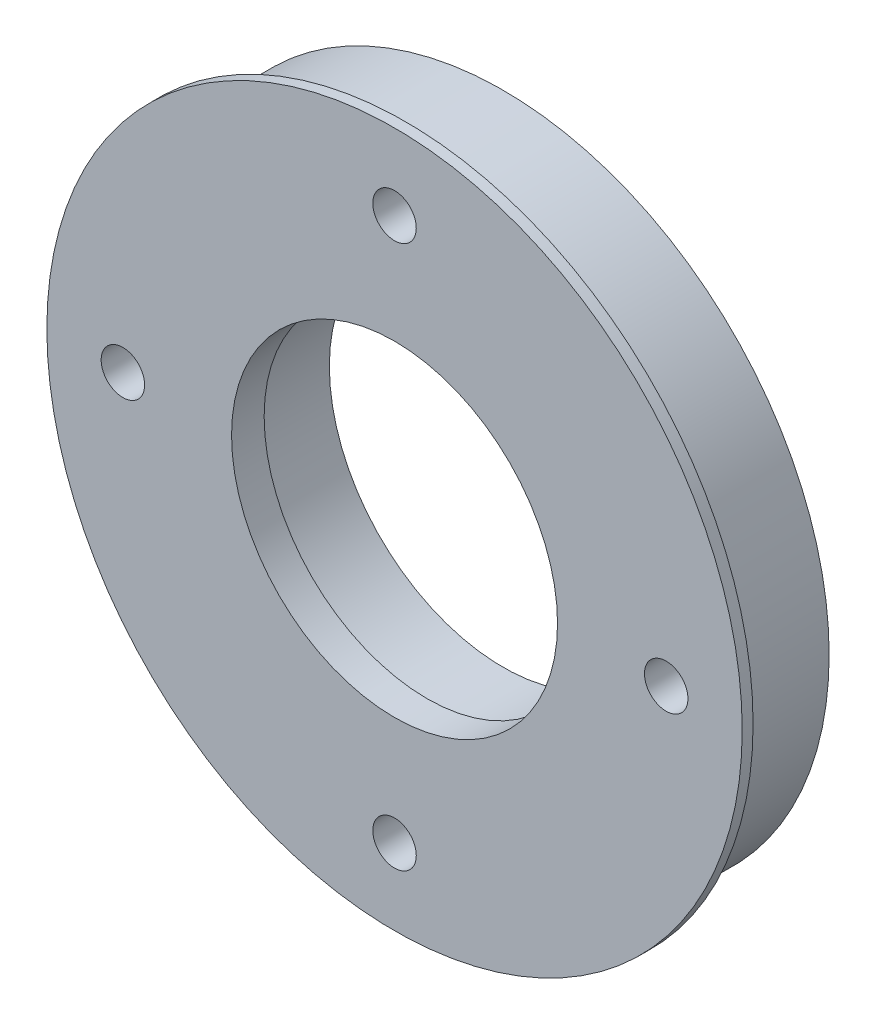
from build123d import *

# Parameters (mm, degrees)
SKETCH1_R           = 29.9974
SKETCH1_R_2         = 16
BOSS_EXTRUDE1_DEPTH = 7
SKETCH2_R           = 2
CUT_EXTRUDE1_DEPTH  = 10
SKETCH3_R           = 16
SKETCH3_R_2         = 15
BOSS_EXTRUDE2_DEPTH = 1
BOSS_EXTRUDE3_START = 3
SKETCH1_3_R         = 29.9974
SKETCH1_3_R_2       = 16
BOSS_EXTRUDE3_DEPTH = 3
BOSS_EXTRUDE4_START = 2
SKETCH3_2_R         = 16
SKETCH3_2_R_2       = 15
BOSS_EXTRUDE4_DEPTH = 2
SKETCH4_R           = 31.9974
SKETCH4_R_2         = 29.9974
BOSS_EXTRUDE5_DEPTH = 1
CUT_EXTRUDE3_START  = -1
SKETCH5_R           = 16
SKETCH5_R_2         = 15
CUT_EXTRUDE3_DEPTH  = 1
SKETCH6_R           = 3
SKETCH6_R_2         = 2
BOSS_EXTRUDE6_DEPTH = 3
CHAMFER1_SIZE       = 3
CUT_EXTRUDE4_START  = -10
SKETCH7_R           = 2
CUT_EXTRUDE4_DEPTH  = 10
BOSS_EXTRUDE7_START = 1
SKETCH8_R           = 16
SKETCH8_R_2         = 15
BOSS_EXTRUDE7_DEPTH = 1


# Read off the part's stored shape, not the designer's step: Cut-Extrude5
with BuildPart() as part:
    # Sketch1 → Boss-Extrude1 (new body)
    with BuildSketch(Plane.XY):
        Circle(SKETCH1_R)
        Circle(SKETCH1_R_2, mode=Mode.SUBTRACT)
    extrude(amount=-BOSS_EXTRUDE1_DEPTH)

    # Sketch2 → Cut-Extrude1 (cut)
    with BuildSketch(Plane.XY):
        with Locations((25, 0)):
            Circle(SKETCH2_R)
        with Locations((0, -25)):
            Circle(SKETCH2_R)
        with Locations((-25, 0)):
            Circle(SKETCH2_R)
        with Locations((0, 25)):
            Circle(SKETCH2_R)
    extrude(amount=-CUT_EXTRUDE1_DEPTH, mode=Mode.SUBTRACT)

    # Sketch3 → Boss-Extrude2 (add)
    with BuildSketch(Plane.XY):
        Circle(SKETCH3_R)
        Circle(SKETCH3_R_2, mode=Mode.SUBTRACT)
    extrude(amount=-BOSS_EXTRUDE2_DEPTH)

    # Sketch1<3> → Boss-Extrude3 (add)
    with BuildSketch(Plane.XY.offset(BOSS_EXTRUDE3_START)):
        Circle(SKETCH1_3_R)
        Circle(SKETCH1_3_R_2, mode=Mode.SUBTRACT)
    extrude(amount=-BOSS_EXTRUDE3_DEPTH)

    # Sketch3<2> → Boss-Extrude4 (add)
    with BuildSketch(Plane.XY.offset(BOSS_EXTRUDE4_START)):
        Circle(SKETCH3_2_R)
        Circle(SKETCH3_2_R_2, mode=Mode.SUBTRACT)
    extrude(amount=-BOSS_EXTRUDE4_DEPTH)

    # Sketch4 → Boss-Extrude5 (add)
    with BuildSketch(Plane.XY.offset(3)):
        Circle(SKETCH4_R)
        Circle(SKETCH4_R_2, mode=Mode.SUBTRACT)
    extrude(amount=-BOSS_EXTRUDE5_DEPTH)

    # Sketch5 → Cut-Extrude3 (cut)
    with BuildSketch(Plane(origin=(0, 0, -1), x_dir=(-1, 0, 0), z_dir=(0, 0, -1)).offset(CUT_EXTRUDE3_START)):
        with Locations(Location((0, 0, 0), (0, 0, 180))):
            Circle(SKETCH5_R)
        with Locations(Location((0, 0, 0), (0, 0, 180))):
            Circle(SKETCH5_R_2, mode=Mode.SUBTRACT)
    extrude(amount=CUT_EXTRUDE3_DEPTH, mode=Mode.SUBTRACT)

    # Sketch6 → Boss-Extrude6 (add)
    # profile 1 of 4: a face of its own
    with BuildSketch(Plane(origin=(0, 0, -7), x_dir=(-1, 0, 0), z_dir=(0, 0, -1))):
        with Locations(Location((-25, 0, 0), (0, 0, 180))):
            Circle(SKETCH6_R)
        with Locations(Location((-25, 0, 0), (0, 0, 180))):
            Circle(SKETCH6_R_2, mode=Mode.SUBTRACT)
    # profile 2 of 4: a face of its own
    with BuildSketch(Plane(origin=(0, 0, -7), x_dir=(-1, 0, 0), z_dir=(0, 0, -1))):
        with Locations(Location((0, -25, 0), (0, 0, 180))):
            Circle(SKETCH6_R)
        with Locations(Location((0, -25, 0), (0, 0, 180))):
            Circle(SKETCH6_R_2, mode=Mode.SUBTRACT)
    # profile 3 of 4: a face of its own
    with BuildSketch(Plane(origin=(0, 0, -7), x_dir=(-1, 0, 0), z_dir=(0, 0, -1))):
        with Locations(Location((25, 0, 0), (0, 0, 180))):
            Circle(SKETCH6_R)
        with Locations(Location((25, 0, 0), (0, 0, 180))):
            Circle(SKETCH6_R_2, mode=Mode.SUBTRACT)
    # profile 4 of 4: a face of its own
    with BuildSketch(Plane(origin=(0, 0, -7), x_dir=(-1, 0, 0), z_dir=(0, 0, -1))):
        with Locations(Location((0, 25, 0), (0, 0, 180))):
            Circle(SKETCH6_R)
        with Locations(Location((0, 25, 0), (0, 0, 180))):
            Circle(SKETCH6_R_2, mode=Mode.SUBTRACT)
    extrude(amount=BOSS_EXTRUDE6_DEPTH)

    # Chamfer1
    # the kernel refuses this chamfer: 3 mm, written as the material it adds along each edge
    with BuildSketch(Plane(origin=(25, 0, -7), x_dir=(1, 0, 0), z_dir=(0, 1, 0))) as chamfer1_piece_1_section:
        Polygon((3 + CHAMFER1_SIZE, 0), (3, CHAMFER1_SIZE), (3, 0), align=None)
    chamfer1_piece_1 = revolve(axis=Axis((25, 0, -7), (0, 0, -1)), mode=Mode.PRIVATE)
    chamfer1_piece_1 = chamfer1_piece_1 & Plane(origin=(0, 0, -8.42256149), x_dir=(1, 0, 0), z_dir=(0, 0, 1)) * Cylinder(29.9974, 25, mode=Mode.PRIVATE)
    chamfer1_piece_1 = split(chamfer1_piece_1, bisect_by=Plane(origin=(20.492585696, 0, -10), z_dir=(0, 0, 1)), keep=Keep.TOP, mode=Mode.PRIVATE)
    add(chamfer1_piece_1)
    with BuildSketch(Plane(origin=(0, -25, -7), x_dir=(1, 0, 0), z_dir=(0, 1, 0))) as chamfer1_piece_2_section:
        Polygon((3 + CHAMFER1_SIZE, 0), (3, CHAMFER1_SIZE), (3, 0), align=None)
    chamfer1_piece_2 = revolve(axis=Axis((0, -25, -7), (0, 0, -1)), mode=Mode.PRIVATE)
    chamfer1_piece_2 = chamfer1_piece_2 & Plane(origin=(0, 0, -8.422561428), x_dir=(1, 0, 0), z_dir=(0, 0, 1)) * Cylinder(29.9974, 25, mode=Mode.PRIVATE)
    chamfer1_piece_2 = split(chamfer1_piece_2, bisect_by=Plane(origin=(-4.507414242, -25, -10), z_dir=(0, 0, 1)), keep=Keep.TOP, mode=Mode.PRIVATE)
    add(chamfer1_piece_2)
    with BuildSketch(Plane(origin=(-25, 0, -7), x_dir=(1, 0, 0), z_dir=(0, 1, 0))) as chamfer1_piece_3_section:
        Polygon((3 + CHAMFER1_SIZE, 0), (3, CHAMFER1_SIZE), (3, 0), align=None)
    chamfer1_piece_3 = revolve(axis=Axis((-25, 0, -7), (0, 0, -1)), mode=Mode.PRIVATE)
    chamfer1_piece_3 = chamfer1_piece_3 & Plane(origin=(0, 0, -8.422561427), x_dir=(1, 0, 0), z_dir=(0, 0, 1)) * Cylinder(29.9974, 25, mode=Mode.PRIVATE)
    chamfer1_piece_3 = split(chamfer1_piece_3, bisect_by=Plane(origin=(-29.507414241, 0, -10), z_dir=(0, 0, 1)), keep=Keep.TOP, mode=Mode.PRIVATE)
    add(chamfer1_piece_3)
    with BuildSketch(Plane(origin=(0, 25, -7), x_dir=(1, 0, 0), z_dir=(0, 1, 0))) as chamfer1_piece_4_section:
        Polygon((3 + CHAMFER1_SIZE, 0), (3, CHAMFER1_SIZE), (3, 0), align=None)
    chamfer1_piece_4 = revolve(axis=Axis((0, 25, -7), (0, 0, -1)), mode=Mode.PRIVATE)
    chamfer1_piece_4 = chamfer1_piece_4 & Plane(origin=(0, 0, -8.422561436), x_dir=(1, 0, 0), z_dir=(0, 0, 1)) * Cylinder(29.9974, 25, mode=Mode.PRIVATE)
    chamfer1_piece_4 = split(chamfer1_piece_4, bisect_by=Plane(origin=(-4.50741425, 25, -10), z_dir=(0, 0, 1)), keep=Keep.TOP, mode=Mode.PRIVATE)
    add(chamfer1_piece_4)

    # Sketch7 → Cut-Extrude4 (cut)
    with BuildSketch(Plane(origin=(0, 0, 0), x_dir=(-1, 0, 0), z_dir=(0, 0, -1)).offset(CUT_EXTRUDE4_START)):
        with Locations(Location((-25, 0, 0), (0, 0, 180))):
            Circle(SKETCH7_R)
        with Locations(Location((0, 25, 0), (0, 0, 180))):
            Circle(SKETCH7_R)
        with Locations(Location((25, 0, 0), (0, 0, 180))):
            Circle(SKETCH7_R)
        with Locations(Location((0, -25, 0), (0, 0, 180))):
            Circle(SKETCH7_R)
    extrude(amount=CUT_EXTRUDE4_DEPTH, mode=Mode.SUBTRACT)

    # Sketch8 → Boss-Extrude7 (add)
    with BuildSketch(Plane.XY.offset(2).offset(BOSS_EXTRUDE7_START)):
        Circle(SKETCH8_R)
        Circle(SKETCH8_R_2, mode=Mode.SUBTRACT)
    extrude(amount=-BOSS_EXTRUDE7_DEPTH)

    # Cut-Extrude5 outline → Cut-Extrude5 (revolve, cut)
    with BuildSketch(Plane(origin=(25, 0, 0), x_dir=(1, 0, 0), z_dir=(0, -1, 0))):
        Polygon((2, -7), (2, -10), (3, -10), (6, -7), align=None)
    revolve(axis=Axis((25, 0, 0), (0, 0, 1)), mode=Mode.SUBTRACT)

    # Cut-Extrude5 2 outline → Cut-Extrude5 2 (revolve, cut)
    with BuildSketch(Plane.XZ.offset(25)):
        Polygon((2, -7), (2, -10), (3, -10), (6, -7), align=None)
    revolve(axis=Axis((0, -25, 0), (0, 0, 1)), mode=Mode.SUBTRACT)

    # Cut-Extrude5 3 outline → Cut-Extrude5 3 (revolve, cut)
    with BuildSketch(Plane(origin=(-25, 0, 0), x_dir=(1, 0, 0), z_dir=(0, -1, 0))):
        Polygon((2, -7), (2, -10), (3, -10), (6, -7), align=None)
    revolve(axis=Axis((-25, 0, 0), (0, 0, 1)), mode=Mode.SUBTRACT)

    # Cut-Extrude5 4 outline → Cut-Extrude5 4 (revolve, cut)
    with BuildSketch(Plane.XZ.offset(-25)):
        Polygon((2, -7), (2, -10), (3, -10), (6, -7), align=None)
    revolve(axis=Axis((0, 25, 0), (0, 0, 1)), mode=Mode.SUBTRACT)


solid = part.part
